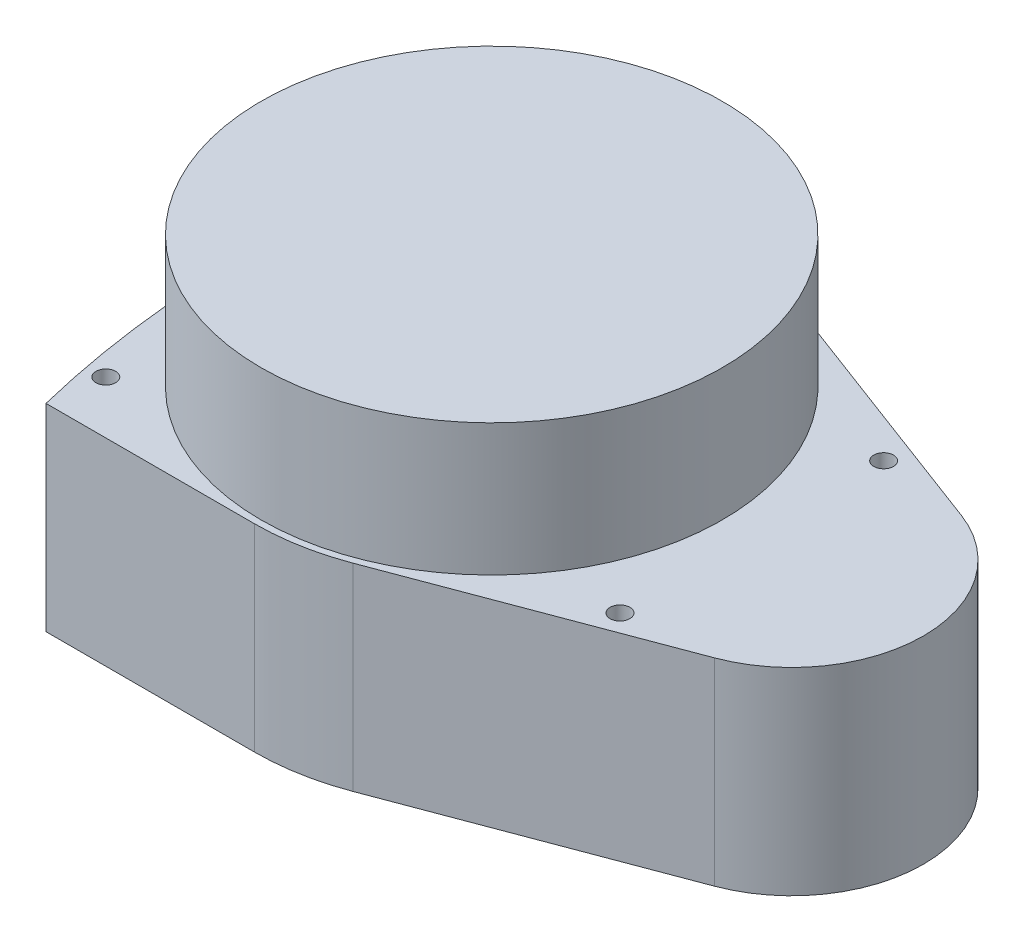
from build123d import *

# Parameters (mm, degrees)
SKETCH_1_R          = 35
EXTRUDE_1_DEPTH     = 20
EXTRUDE_2_DEPTH     = 30
SKETCH_4_R          = 1.5
CUT_EXTRUDE_1_DEPTH = 81.537258458


with BuildPart() as part:
    # 草图1 → 凸台-拉伸1 (new body)
    with BuildSketch(Plane(origin=(0, 0, 0), x_dir=(1, 0, 0), z_dir=(0, 1, 0))):
        Circle(SKETCH_1_R)
    extrude(amount=EXTRUDE_1_DEPTH)

    # 草图2 → 凸台-拉伸2 (add)
    with BuildSketch(Plane(origin=(0, 0, 0), x_dir=(1, 0, 0), z_dir=(0, 1, 0))):
        with BuildLine():
            Line((52.532967033, 18.722643369), (12.659340659, 33.700758064))
            ThreePointArc((12.659340659, 33.700758064), (6.433222742, 35.42052576), (0, 36))
            Line((0, 36), (-31.615933194, 36))
            ThreePointArc((-31.615933194, 36), (-34.899949596, 18.132981289), (-36, 0))
            Line((-36, 0), (65.5, 0))
            ThreePointArc((65.5, 0), (61.941705214, 11.387288074), (52.532967033, 18.722643369))
        make_face()
    extrude_2 = extrude(amount=-EXTRUDE_2_DEPTH)

    # 镜向1: 凸台-拉伸2 across plane
    add(extrude_2.mirror(Plane(origin=(-36, -30, 0), x_dir=(1, 0, 0), z_dir=(0, 0, 1))))

    # 草图4 → 切除-拉伸1 (cut, through all)
    with BuildSketch(Plane(origin=(0, 0, 0), x_dir=(1, 0, 0), z_dir=(0, 1, 0))):
        with Locations((-30.54, 28)):
            Circle(SKETCH_4_R)
        with Locations((39.46, 20)):
            Circle(SKETCH_4_R)
    cut_extrude_1 = extrude(amount=-CUT_EXTRUDE_1_DEPTH, mode=Mode.SUBTRACT)

    # 镜向2: 切除-拉伸1 across plane
    add(cut_extrude_1.mirror(Plane.XY), mode=Mode.SUBTRACT)


solid = part.part
